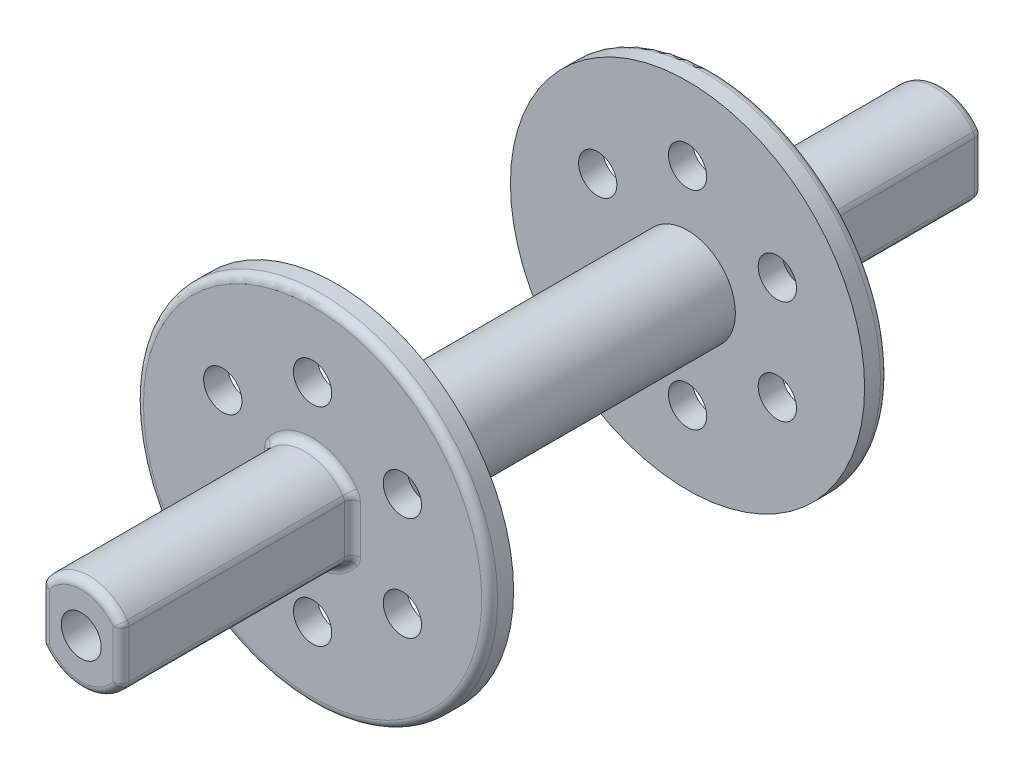
from build123d import *

# Parameters (mm, degrees)
CORTAR_EXTRUIR1_REACH = 64.463
REDONDEO2_R           = 1
CROQUIS4_R            = 2.4
CORTAR_EXTRUIR2_DEPTH = 63.463429387
MATRIZC1_COUNT        = 6


with BuildPart() as part:
    # Croquis1 → Revolución4 (revolve)
    with BuildSketch(Plane(origin=(0, 0, 0), x_dir=(0, 0, -1), z_dir=(1, 0, 0)), mode=Mode.PRIVATE) as revoluci_n4_sk:
        Polygon((-25, 22.2), (-25, 6), (-26, 6), (-54, 6), (-54, 2.5), (-25, 2.5), (0, 2.5), (0, 6), (-22, 6), (-22, 22.2), align=None)
    revolve(revoluci_n4_sk.sketch.rotate(Axis((0, 0, 55.074829932), (0, 0, -1)), 90), axis=Axis((0, 0, 55.074829932), (0, 0, -1)))

    # Cortar-Extruir1: up to this face of the body (flat: up to its plane)
    cortar_extruir1_end = Plane(part.part.faces().sort_by_distance((-21.572089178, 0, 25))[0])
    # Croquis3 → Cortar-Extruir1 (cut, up to the picked face)
    with BuildSketch(Plane.XY.offset(54), mode=Mode.PRIVATE) as cortar_extruir1_sk1:
        with BuildLine():
            Line((-5, 3.31662479), (-5, -3.31662479))
            ThreePointArc((-5, -3.31662479), (-6, 0), (-5, 3.31662479))
        make_face()
    cortar_extruir1_tool1 = split(extrude(cortar_extruir1_sk1.sketch, amount=-CORTAR_EXTRUIR1_REACH, mode=Mode.PRIVATE), bisect_by=cortar_extruir1_end, keep=Keep.BOTH, mode=Mode.PRIVATE)
    # Croquis3 → Cortar-Extruir1 (cut, up to the picked face)
    with BuildSketch(Plane.XY.offset(54), mode=Mode.PRIVATE) as cortar_extruir1_sk2:
        with BuildLine():
            Line((5, 3.31662479), (5, -3.31662479))
            ThreePointArc((5, -3.31662479), (6, 0), (5, 3.31662479))
        make_face()
    cortar_extruir1_tool2 = split(extrude(cortar_extruir1_sk2.sketch, amount=-CORTAR_EXTRUIR1_REACH, mode=Mode.PRIVATE), bisect_by=cortar_extruir1_end, keep=Keep.BOTH, mode=Mode.PRIVATE)
    add(cortar_extruir1_tool1.solids().sort_by(Axis((-5.403002, 0, 54), (0, 0, -1)))[0], mode=Mode.SUBTRACT)
    add(cortar_extruir1_tool2.solids().sort_by(Axis((5.403002, 0, 54), (0, 0, -1)))[0], mode=Mode.SUBTRACT)

    # Redondeo2
    redondeo2_edges = [part.edges().sort_by_distance(p)[0] for p in [
        (-5, 0, 25),
        (0, 6, 25),
        (0, -6, 25),
        (5, 0, 54),
        (-5, 0, 54),
        (5, 0, 25),
        (-22.2, 0, 25),
        (0, -6, 54),
        (0, 6, 54),
        (-5, 3.31662479, 39.5),
        (5, 3.31662479, 39.5),
        (5, -3.31662479, 39.5),
    ]]
    fillet(redondeo2_edges, radius=REDONDEO2_R - 0.0001)  # a hair under: the kernel refuses the full size

    # Simetría1: part across plane


with BuildPart() as part_1:
    add(part.part)
    add(part.part.mirror(Plane.XY))

    # Croquis4 → Cortar-Extruir2 (cut, symmetric)
    with BuildSketch(Plane.XY):
        with Locations((0, 13)):
            Circle(CROQUIS4_R)
    cortar_extruir2 = extrude(amount=CORTAR_EXTRUIR2_DEPTH, both=True, mode=Mode.SUBTRACT)

    # MatrizC1: Cortar-Extruir2 ×6 about axis
    matrizc1_axis = Axis((0, 0, 0), (0, 0, 1))
    for i in range(1, MATRIZC1_COUNT):
        add(cortar_extruir2.rotate(matrizc1_axis, i * 360 / MATRIZC1_COUNT), mode=Mode.SUBTRACT)


solid = part_1.part
